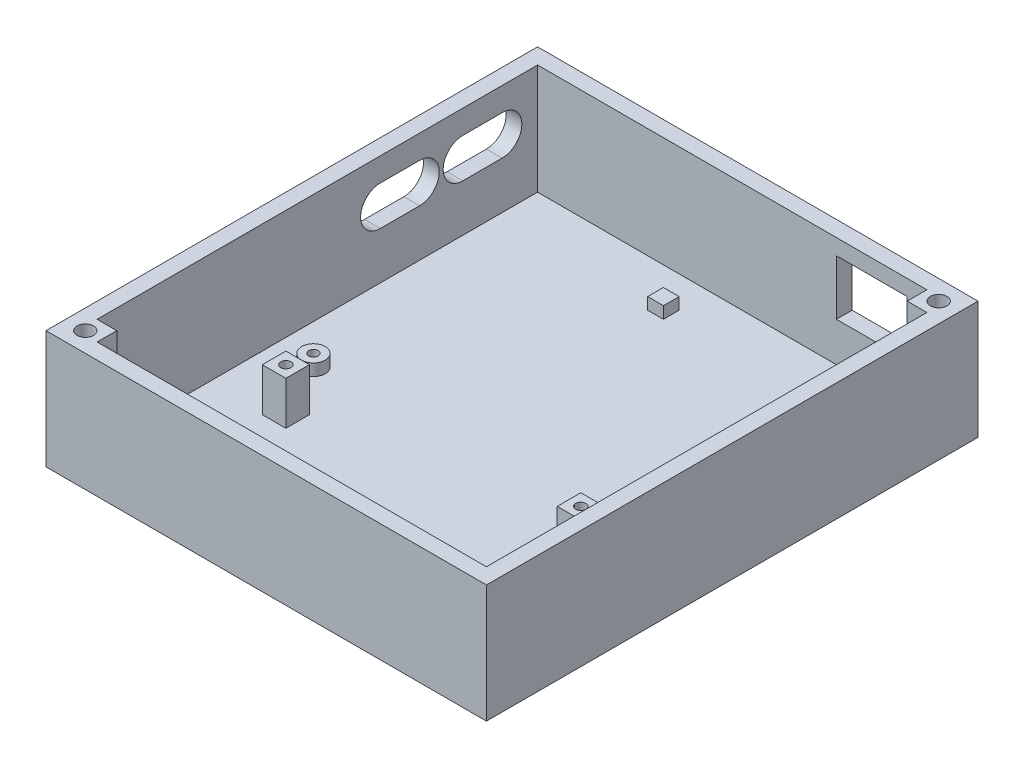
from build123d import *

# Parameters (mm, degrees)
SKETCH1_W           = 112
SKETCH1_H           = 125
BOSS_EXTRUDE1_DEPTH = 2
SKETCH2_W           = 112
SKETCH2_H           = 125
SKETCH2_R           = 2.1
BOSS_EXTRUDE2_DEPTH = 10
SKETCH3_W           = 6
SKETCH3_H           = 6
SKETCH3_R           = 1.3
BOSS_EXTRUDE3_DEPTH = 11
SKETCH5_R           = 3
SKETCH5_R_2         = 1.2
SKETCH5_W           = 4
SKETCH5_H           = 4
BOSS_EXTRUDE4_DEPTH = 3
SKETCH6_W           = 6
SKETCH6_H           = 6
SKETCH6_R           = 1.3
BOSS_EXTRUDE5_DEPTH = 6.3
SKETCH7_W           = 112
SKETCH7_H           = 125
SKETCH7_R           = 2.1
BOSS_EXTRUDE6_DEPTH = 18
CUT_EXTRUDE1_REACH  = 133.72
CUT_EXTRUDE2_REACH  = 142.218
SKETCH10_W          = 18
SKETCH10_H          = 14


with BuildPart() as part:
    # Sketch1 → Boss-Extrude1 (new body)
    with BuildSketch(Plane(origin=(0, 0, 0), x_dir=(1, 0, 0), z_dir=(0, 1, 0))):
        Rectangle(SKETCH1_W, SKETCH1_H)
    extrude(amount=BOSS_EXTRUDE1_DEPTH)

    # Sketch2 → Boss-Extrude2 (add)
    with BuildSketch(Plane(origin=(0, 2, 0), x_dir=(1, 0, 0), z_dir=(0, 1, 0))):
        Rectangle(SKETCH2_W, SKETCH2_H)
        Polygon((47, 53.5), (52, 53.5), (52, -58.5), (-47, -58.5), (-47, -53.5), (-52, -53.5), (-52, 58.5), (47, 58.5), align=None, mode=Mode.SUBTRACT)
        with Locations((51, 57.5)):
            Circle(SKETCH2_R, mode=Mode.SUBTRACT)
        with Locations((-51, -57.5)):
            Circle(SKETCH2_R, mode=Mode.SUBTRACT)
    extrude(amount=BOSS_EXTRUDE2_DEPTH)

    # Sketch3 → Boss-Extrude3 (add)
    # profile 1 of 4: a face of its own
    with BuildSketch(Plane(origin=(0, 2, 0), x_dir=(1, 0, 0), z_dir=(0, 1, 0))):
        with Locations((-35, -22.5)):
            Rectangle(SKETCH3_W, SKETCH3_H)
        with Locations((-35, -22.5)):
            Circle(SKETCH3_R, mode=Mode.SUBTRACT)
    # profile 2 of 4: a face of its own
    with BuildSketch(Plane(origin=(0, 2, 0), x_dir=(1, 0, 0), z_dir=(0, 1, 0))):
        with Locations((40, -22.5)):
            Rectangle(SKETCH3_W, SKETCH3_H)
        with Locations((40, -22.5)):
            Circle(SKETCH3_R, mode=Mode.SUBTRACT)
    # profile 3 of 4: a face of its own
    with BuildSketch(Plane(origin=(0, 2, 0), x_dir=(1, 0, 0), z_dir=(0, 1, 0))):
        with Locations((-35, -53.5)):
            Rectangle(SKETCH3_W, SKETCH3_H)
        with Locations((-35, -53.5)):
            Circle(SKETCH3_R, mode=Mode.SUBTRACT)
    # profile 4 of 4: a face of its own
    with BuildSketch(Plane(origin=(0, 2, 0), x_dir=(1, 0, 0), z_dir=(0, 1, 0))):
        with Locations((40, -53.5)):
            Rectangle(SKETCH3_W, SKETCH3_H)
        with Locations((40, -53.5)):
            Circle(SKETCH3_R, mode=Mode.SUBTRACT)
    extrude(amount=BOSS_EXTRUDE3_DEPTH)

    # Sketch5 → Boss-Extrude4 (add)
    # profile 1 of 3: a face of its own
    with BuildSketch(Plane(origin=(0, 2, 0), x_dir=(1, 0, 0), z_dir=(0, 1, 0))):
        with Locations((-42, -8.5)):
            Circle(SKETCH5_R)
        with Locations((-42, -8.5)):
            Circle(SKETCH5_R_2, mode=Mode.SUBTRACT)
    # profile 2 of 3: a face of its own
    with BuildSketch(Plane(origin=(0, 2, 0), x_dir=(1, 0, 0), z_dir=(0, 1, 0))):
        with Locations((38, -8.5)):
            Circle(SKETCH5_R)
        with Locations((38, -8.5)):
            Circle(SKETCH5_R_2, mode=Mode.SUBTRACT)
    # profile 3 of 3: a face of its own
    with BuildSketch(Plane(origin=(0, 2, 0), x_dir=(1, 0, 0), z_dir=(0, 1, 0))):
        with Locations((-10, 48.5)):
            Rectangle(SKETCH5_W, SKETCH5_H)
    extrude(amount=BOSS_EXTRUDE4_DEPTH)

    # Sketch6 → Boss-Extrude5 (add)
    # profile 1 of 3: a face of its own
    with BuildSketch(Plane(origin=(0, 13, 0), x_dir=(1, 0, 0), z_dir=(0, 1, 0))):
        with Locations((-35, -53.5)):
            Rectangle(SKETCH6_W, SKETCH6_H)
        with Locations((-35, -53.5)):
            Circle(SKETCH6_R, mode=Mode.SUBTRACT)
    # profile 2 of 3: a face of its own
    with BuildSketch(Plane(origin=(0, 13, 0), x_dir=(1, 0, 0), z_dir=(0, 1, 0))):
        with Locations((40, -22.5)):
            Rectangle(SKETCH6_W, SKETCH6_H)
        with Locations((40, -22.5)):
            Circle(SKETCH6_R, mode=Mode.SUBTRACT)
    # profile 3 of 3: a face of its own
    with BuildSketch(Plane(origin=(0, 13, 0), x_dir=(1, 0, 0), z_dir=(0, 1, 0))):
        with Locations((40, -53.5)):
            Rectangle(SKETCH6_W, SKETCH6_H)
        with Locations((40, -53.5)):
            Circle(SKETCH6_R, mode=Mode.SUBTRACT)
    extrude(amount=BOSS_EXTRUDE5_DEPTH)

    # Sketch7 → Boss-Extrude6 (add)
    with BuildSketch(Plane(origin=(0, 12, 0), x_dir=(1, 0, 0), z_dir=(0, 1, 0))):
        Rectangle(SKETCH7_W, SKETCH7_H)
        with Locations((-51, -57.5)):
            Circle(SKETCH7_R, mode=Mode.SUBTRACT)
        Polygon((47, 58.5), (47, 53.5), (52, 53.5), (52, -58.5), (-47, -58.5), (-47, -53.5), (-52, -53.5), (-52, 58.5), align=None, mode=Mode.SUBTRACT)
        with Locations((51, 57.5)):
            Circle(SKETCH7_R, mode=Mode.SUBTRACT)
    extrude(amount=BOSS_EXTRUDE6_DEPTH)

    # Sketch9 → Cut-Extrude1 (cut, up to next)
    with BuildSketch(Plane.ZY.offset(56), mode=Mode.PRIVATE) as cut_extrude1_sk1:
        with BuildLine():
            Line((-49.5, 24), (-39.5, 24))
            ThreePointArc((-39.5, 24), (-34.5, 19), (-39.5, 14))
            Line((-39.5, 14), (-49.5, 14))
            ThreePointArc((-49.5, 14), (-54.5, 19), (-49.5, 24))
        make_face()
    cut_extrude1_tool1 = extrude(cut_extrude1_sk1.sketch, amount=-CUT_EXTRUDE1_REACH, mode=Mode.PRIVATE) & part.part
    # Sketch9 → Cut-Extrude1 (cut, up to next)
    with BuildSketch(Plane.ZY.offset(56), mode=Mode.PRIVATE) as cut_extrude1_sk2:
        with BuildLine():
            Line((-28.5, 24), (-18.5, 24))
            ThreePointArc((-18.5, 24), (-13.5, 19), (-18.5, 14))
            Line((-18.5, 14), (-28.5, 14))
            ThreePointArc((-28.5, 14), (-33.5, 19), (-28.5, 24))
        make_face()
    cut_extrude1_tool2 = extrude(cut_extrude1_sk2.sketch, amount=-CUT_EXTRUDE1_REACH, mode=Mode.PRIVATE) & part.part
    add(cut_extrude1_tool1.solids().sort_by_distance((-56, 19, -44.5))[0], mode=Mode.SUBTRACT)
    add(cut_extrude1_tool2.solids().sort_by_distance((-56, 19, -23.5))[0], mode=Mode.SUBTRACT)

    # Sketch10 → Cut-Extrude2 (cut, up to next)
    with BuildSketch(Plane(origin=(0, 0, -62.5), x_dir=(-1, 0, 0), z_dir=(0, 0, -1)), mode=Mode.PRIVATE) as cut_extrude2_sk1:
        with Locations((-33, 19)):
            Rectangle(SKETCH10_W, SKETCH10_H)
    cut_extrude2_tool1 = extrude(cut_extrude2_sk1.sketch, amount=-CUT_EXTRUDE2_REACH, mode=Mode.PRIVATE) & part.part
    add(cut_extrude2_tool1.solids().sort_by_distance((33, 19, -62.5))[0], mode=Mode.SUBTRACT)


solid = part.part
